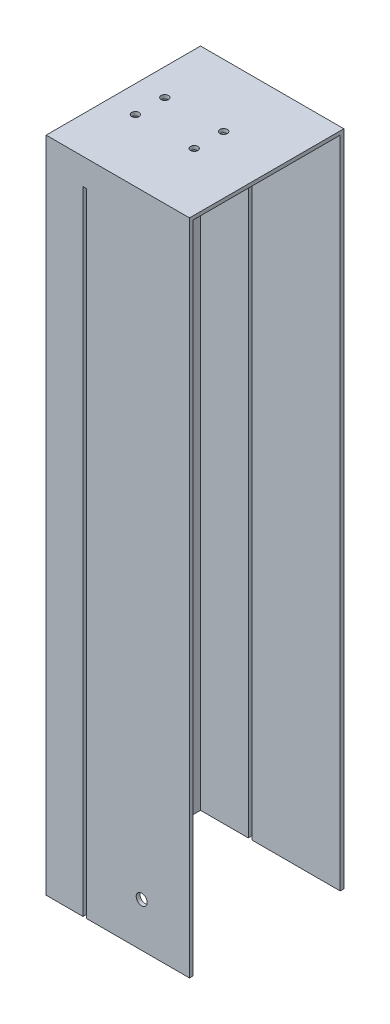
from build123d import *

# Parameters (mm, degrees)
SKETCH1_W            = 42
SKETCH1_H            = 170
BOSS_EXTRUDE1_DEPTH  = 1
SKETCH2_W            = 1
SKETCH2_H            = 170
BOSS_EXTRUDE2_DEPTH  = 50
BOSS_EXTRUDE3_DEPTH  = 30
SKETCH5_W            = 1
SKETCH5_H            = 1
CUT_EXTRUDE1_DEPTH   = 170
SKETCH6_W            = 1
SKETCH6_H            = 1
CUT_EXTRUDE2_DEPTH   = 170
SKETCH9_R            = 1.5
CUT_EXTRUDE3_DEPTH   = 10
SKETCH10_R           = 1.5
CUT_EXTRUDE4_DEPTH   = 10
SKETCH11_R           = 2.028327886
BOSS_EXTRUDE4_DEPTH  = 1
SKETCH13_W           = 40
SKETCH13_H           = 22.9
BOSS_EXTRUDE5_DEPTH  = 50
SKETCH14_W           = 42
SKETCH14_H           = 21.9
CUT_EXTRUDE6_DEPTH   = 60
SKETCH17_R           = 1
CUT_EXTRUDE7_DEPTH   = 10
SKETCH18_W           = 40
SKETCH18_H           = 1
SKETCH18_W_2         = 36
SKETCH18_W_3         = 13
SKETCH18_W_4         = 9
BOSS_EXTRUDE7_DEPTH  = 1
SKETCH19_W           = 1
SKETCH19_H           = 42
BOSS_EXTRUDE8_DEPTH  = 1
SKETCH20_W           = 1.000149207
SKETCH20_H           = 1
CUT_EXTRUDE8_DEPTH   = 1
SKETCH21_W           = 1
SKETCH21_H           = 1
CUT_EXTRUDE9_DEPTH   = 1
BOSS_EXTRUDE9_REACH  = 175.947
SKETCH22_W           = 1
SKETCH22_H           = 31
SKETCH26_W           = 11.5
SKETCH26_H           = 42
BOSS_EXTRUDE13_DEPTH = 1
SKETCH35_W           = 40
SKETCH35_H           = 31
CUT_EXTRUDE17_DEPTH  = 27
SKETCH36_W           = 42
SKETCH36_H           = 1
CUT_EXTRUDE18_DEPTH  = 24
SKETCH37_W           = 12
SKETCH37_H           = 212.744224338
CUT_EXTRUDE19_DEPTH  = 50


with BuildPart() as part:
    # Sketch1 → Boss-Extrude1 (new body)
    with BuildSketch(Plane(origin=(0, 0, 0), x_dir=(0, 0, -1), z_dir=(1, 0, 0))):
        with Locations((7.169014085, -74.911791253)):
            Rectangle(SKETCH1_W, SKETCH1_H)
    extrude(amount=BOSS_EXTRUDE1_DEPTH)

    # Sketch2 → Boss-Extrude2 (add)
    with BuildSketch(Plane(origin=(1, 0, 0), x_dir=(0, 0, -1), z_dir=(1, 0, 0))):
        with Locations((27.669014085, -74.911791253)):
            Rectangle(SKETCH2_W, SKETCH2_H)
        with Locations((-13.330985915, -74.911791253)):
            Rectangle(SKETCH2_W, SKETCH2_H)
    extrude(amount=BOSS_EXTRUDE2_DEPTH)

    # Sketch4 → Boss-Extrude3 (add)
    with BuildSketch(Plane(origin=(0, 10.088208747, 0), x_dir=(1, 0, 0), z_dir=(0, 1, 0))):
        Polygon((51, 28.169014085), (51, 27.169014085), (1, 27.169014085), (1, -12.830985915), (51, -12.830985915), (51, -13.830985915), (0, -13.830985915), (0, 28.169014085), align=None)
    extrude(amount=BOSS_EXTRUDE3_DEPTH)

    # Sketch5 → Cut-Extrude1 (cut)
    with BuildSketch(Plane.XZ.offset(159.911791253)):
        with Locations((10.5, 13.330985915)):
            Rectangle(SKETCH5_W, SKETCH5_H)
    extrude(amount=-CUT_EXTRUDE1_DEPTH, mode=Mode.SUBTRACT)

    # Sketch6 → Cut-Extrude2 (cut)
    with BuildSketch(Plane.XZ.offset(159.911791253)):
        with Locations((14.5, -27.669014085)):
            Rectangle(SKETCH6_W, SKETCH6_H)
    extrude(amount=-CUT_EXTRUDE2_DEPTH, mode=Mode.SUBTRACT)

    # Sketch9 → Cut-Extrude3 (cut)
    with BuildSketch(Plane.XY.offset(13.830985915)):
        with Locations((26, -144.911791253)):
            Circle(SKETCH9_R)
    extrude(amount=-CUT_EXTRUDE3_DEPTH, mode=Mode.SUBTRACT)

    # Sketch10 → Cut-Extrude4 (cut)
    with BuildSketch(Plane.XY.offset(13.830985915)):
        with Locations((26, -148.911791253)):
            Circle(SKETCH10_R)
    extrude(amount=-CUT_EXTRUDE4_DEPTH, mode=Mode.SUBTRACT)

    # Sketch11 → Boss-Extrude4 (add)
    with BuildSketch(Plane.XY.offset(13.830985915)):
        with Locations((26, -144.911791253)):
            Circle(SKETCH11_R)
    extrude(amount=-BOSS_EXTRUDE4_DEPTH)

    # Sketch13 → Boss-Extrude5 (add)
    with BuildSketch(Plane(origin=(1, 0, 0), x_dir=(0, 0, -1), z_dir=(1, 0, 0))):
        with Locations((7.169014085, 28.638208747)):
            Rectangle(SKETCH13_W, SKETCH13_H)
    extrude(amount=BOSS_EXTRUDE5_DEPTH)

    # Sketch14 → Cut-Extrude6 (cut)
    with BuildSketch(Plane(origin=(51, 0, 0), x_dir=(0, 0, -1), z_dir=(1, 0, 0))):
        with Locations((7.169014085, 29.138208747)):
            Rectangle(SKETCH14_W, SKETCH14_H)
    extrude(amount=-CUT_EXTRUDE6_DEPTH, mode=Mode.SUBTRACT)

    # Sketch17 → Cut-Extrude7 (cut)
    with BuildSketch(Plane.XZ.offset(-17.188208747)):
        with Locations((23.29, -11.169014085)):
            Circle(SKETCH17_R)
        with Locations((23.29, -3.169014085)):
            Circle(SKETCH17_R)
        with Locations((7.29, -11.169014085)):
            Circle(SKETCH17_R)
        with Locations((7.29, -3.169014085)):
            Circle(SKETCH17_R)
    extrude(amount=-CUT_EXTRUDE7_DEPTH, mode=Mode.SUBTRACT)

    # Sketch18 → Boss-Extrude7 (add)
    with BuildSketch(Plane.XZ.offset(159.911791253)):
        with Locations((31, 13.330985915)):
            Rectangle(SKETCH18_W, SKETCH18_H)
        with Locations((33, -27.669014085)):
            Rectangle(SKETCH18_W_2, SKETCH18_H)
        with Locations((7.5, -27.669014085)):
            Rectangle(SKETCH18_W_3, SKETCH18_H)
        with Locations((5.5, 13.330985915)):
            Rectangle(SKETCH18_W_4, SKETCH18_H)
    extrude(amount=BOSS_EXTRUDE7_DEPTH)

    # Sketch19 → Boss-Extrude8 (add)
    with BuildSketch(Plane.XZ.offset(159.911791253)):
        with Locations((0.5, -7.169014085)):
            Rectangle(SKETCH19_W, SKETCH19_H)
    extrude(amount=BOSS_EXTRUDE8_DEPTH)

    # Sketch20 → Cut-Extrude8 (cut)
    with BuildSketch(Plane(origin=(0, 0, -28.169014085), x_dir=(-1, 0, 0), z_dir=(0, 0, -1))):
        with Locations((-14.499925397, 10.588208747)):
            Rectangle(SKETCH20_W, SKETCH20_H)
    extrude(amount=-CUT_EXTRUDE8_DEPTH, mode=Mode.SUBTRACT)

    # Sketch21 → Cut-Extrude9 (cut)
    with BuildSketch(Plane.XY.offset(13.830985915)):
        with Locations((10.5, 10.588208747)):
            Rectangle(SKETCH21_W, SKETCH21_H)
    extrude(amount=-CUT_EXTRUDE9_DEPTH, mode=Mode.SUBTRACT)

    # Sketch22 → Boss-Extrude9 (add, up to next)
    with BuildSketch(Plane.XY.offset(13.830985915), mode=Mode.PRIVATE) as boss_extrude9_sk1:
        with Locations((38.5, -145.411791253)):
            Rectangle(SKETCH22_W, SKETCH22_H)
    boss_extrude9_tool1 = extrude(boss_extrude9_sk1.sketch, amount=-BOSS_EXTRUDE9_REACH, mode=Mode.PRIVATE) - part.part
    add(boss_extrude9_tool1.solids().sort_by_distance((38.5, -145.411791, 13.830986))[0])

    # Sketch26 → Boss-Extrude13 (add)
    with BuildSketch(Plane(origin=(0, -160.911791253, 0), x_dir=(-1, 0, 0), z_dir=(0, -1, 0))):
        with Locations((-22.127481667, 7.169014085)):
            Rectangle(SKETCH26_W, SKETCH26_H)
    extrude(amount=BOSS_EXTRUDE13_DEPTH)

    # Sketch35 → Cut-Extrude17 (cut)
    with BuildSketch(Plane(origin=(39, 0, 0), x_dir=(0, 0, -1), z_dir=(1, 0, 0))):
        with Locations((7.169014085, -145.411791253)):
            Rectangle(SKETCH35_W, SKETCH35_H)
    extrude(amount=-CUT_EXTRUDE17_DEPTH, mode=Mode.SUBTRACT)

    # Sketch36 → Cut-Extrude18 (cut)
    with BuildSketch(Plane(origin=(27.877481667, 0, 0), x_dir=(0, 0, -1), z_dir=(1, 0, 0))):
        with Locations((7.169014085, -161.411791253)):
            Rectangle(SKETCH36_W, SKETCH36_H)
    extrude(amount=-CUT_EXTRUDE18_DEPTH, mode=Mode.SUBTRACT)

    # Sketch37 → Cut-Extrude19 (cut)
    with BuildSketch(Plane.XY.offset(13.830985915)):
        with Locations((45, -54.539679084)):
            Rectangle(SKETCH37_W, SKETCH37_H)
    extrude(amount=-CUT_EXTRUDE19_DEPTH, mode=Mode.SUBTRACT)


solid = part.part
